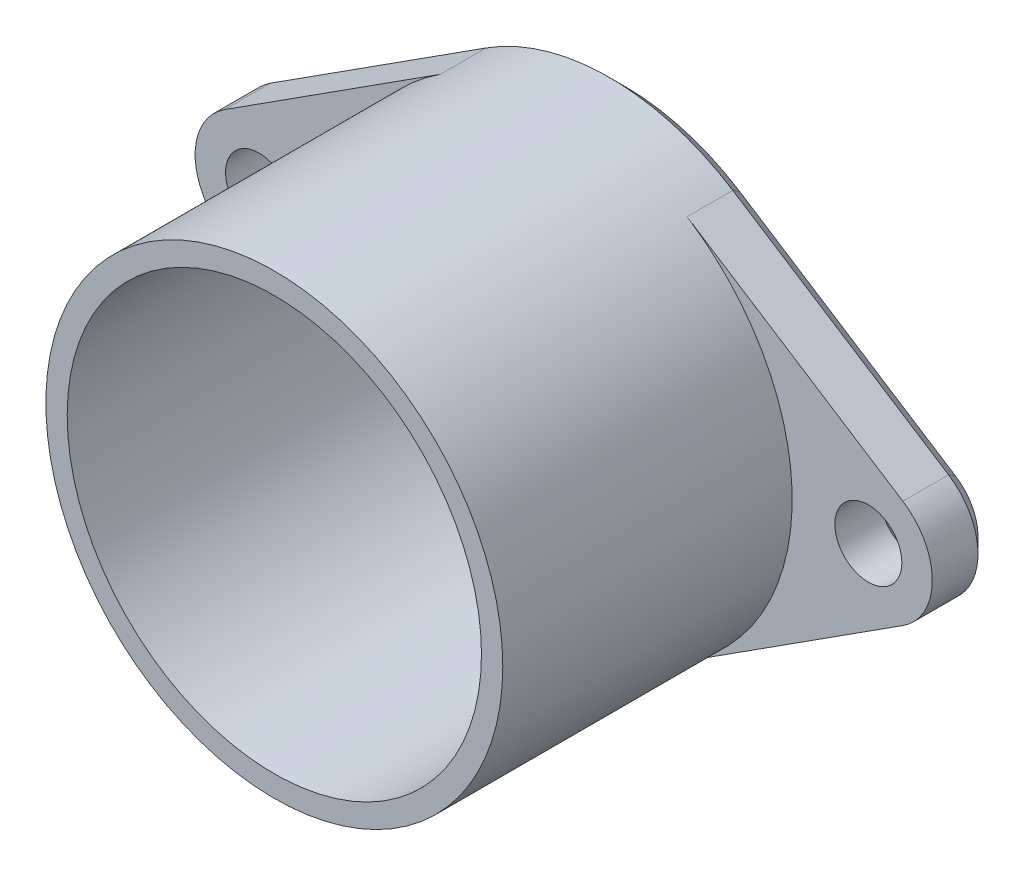
from build123d import *

# Parameters (mm, degrees)
SKETCH_2_R          = 1.1
SKETCH_2_R_2        = 1
SKETCH_2_R_3        = 1.7
EXTRUDE_1_DEPTH     = 2
SKETCH_3_R          = 7.5
SKETCH_3_R_2        = 6.8
EXTRUDE_1_2_DEPTH   = 9.5
CUT_EXTRUDE_START   = -0.5
SKETCH_4_R          = 6.8
CUT_EXTRUDE_1_DEPTH = 0.5
SKETCH_5_R          = 2.25
CUT_EXTRUDE_2_DEPTH = 0.9
CHAMFER_1_SIZE      = 0.5


with BuildPart() as part:
    # Эскиз2 → Extrude 1 (new body)
    with BuildSketch(Plane.XY):
        with BuildLine():
            Line((4.05, 6.312487624), (11.134, 1.767496535))
            ThreePointArc((11.134, 1.767496535), (12.1, 0), (11.134, -1.767496535))
            Line((11.134, -1.767496535), (4.05, -6.312487624))
            ThreePointArc((4.05, -6.312487624), (0, -7.5), (-4.05, -6.312487624))
            Line((-4.05, -6.312487624), (-11.134, -1.767496535))
            ThreePointArc((-11.134, -1.767496535), (-12.1, 0), (-11.134, 1.767496535))
            Line((-11.134, 1.767496535), (-4.05, 6.312487624))
            ThreePointArc((-4.05, 6.312487624), (0, 7.5), (4.05, 6.312487624))
        make_face()
        with Locations((10, 0)):
            Circle(SKETCH_2_R, mode=Mode.SUBTRACT)
        with Locations((-10, 0)):
            Circle(SKETCH_2_R, mode=Mode.SUBTRACT)
        with Locations((0, 4.5)):
            Circle(SKETCH_2_R_2, mode=Mode.SUBTRACT)
        with Locations(Location((0, -4.5, 0), (0, 0, 180))):
            Circle(SKETCH_2_R_2, mode=Mode.SUBTRACT)
        Circle(SKETCH_2_R_3, mode=Mode.SUBTRACT)
    extrude(amount=EXTRUDE_1_DEPTH)

    # Эскиз3 → Extrude 1 2 (add)
    with BuildSketch(Plane.XY.offset(2)):
        Circle(SKETCH_3_R)
        Circle(SKETCH_3_R_2, mode=Mode.SUBTRACT)
    extrude(amount=EXTRUDE_1_2_DEPTH)

    # Эскиз4 → Вырез-Вытянуть1 (cut)
    with BuildSketch(Plane.XY.offset(2).offset(CUT_EXTRUDE_START)):
        Circle(SKETCH_4_R)
    extrude(amount=CUT_EXTRUDE_1_DEPTH, mode=Mode.SUBTRACT)

    # Эскиз5 → Вырез-Вытянуть2 (cut)
    with BuildSketch(Plane.XY.offset(1.5)):
        Circle(SKETCH_5_R)
    extrude(amount=-CUT_EXTRUDE_2_DEPTH, mode=Mode.SUBTRACT)

    # Фаска1
    chamfer_1_edges = [part.edges().sort_by_distance(p)[0] for p in [
        (-7.592, 4.039992079, 0),
        (0, 7.5, 0),
        (8.9, 0, 0),
        (-1, 4.5, 0),
        (1, -4.5, 0),
        (-1.7, 0, 0),
        (-11.1, 0, 0),
        (7.592, 4.039992079, 0),
        (12.1, 0, 0),
        (7.592, -4.039992079, 0),
        (0, -7.5, 0),
        (-7.592, -4.039992079, 0),
        (-12.1, 0, 0),
    ]]
    chamfer(chamfer_1_edges, length=CHAMFER_1_SIZE - 0.0001)  # a hair under: the kernel refuses the full size


solid = part.part
